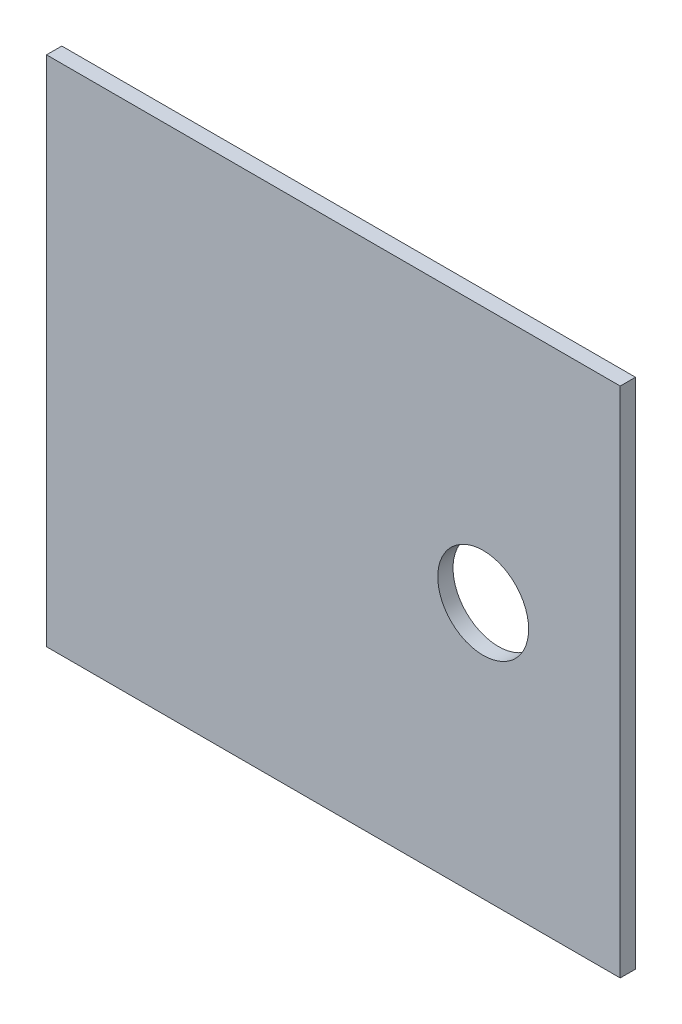
from build123d import *

# Parameters (mm, degrees)
CROQUIS1_W              = 94
CROQUIS1_H              = 84
CROQUIS1_R              = 7.445624545
SALIENTE_EXTRUIR1_DEPTH = 2.5


with BuildPart() as part:
    # Croquis1 → Saliente-Extruir1 (new body)
    with BuildSketch(Plane.XY):
        with Locations((-17.9, 28.75)):
            Rectangle(CROQUIS1_W, CROQUIS1_H)
        with Locations((6.65, 28.75)):
            Circle(CROQUIS1_R, mode=Mode.SUBTRACT)
    extrude(amount=SALIENTE_EXTRUIR1_DEPTH)


solid = part.part
